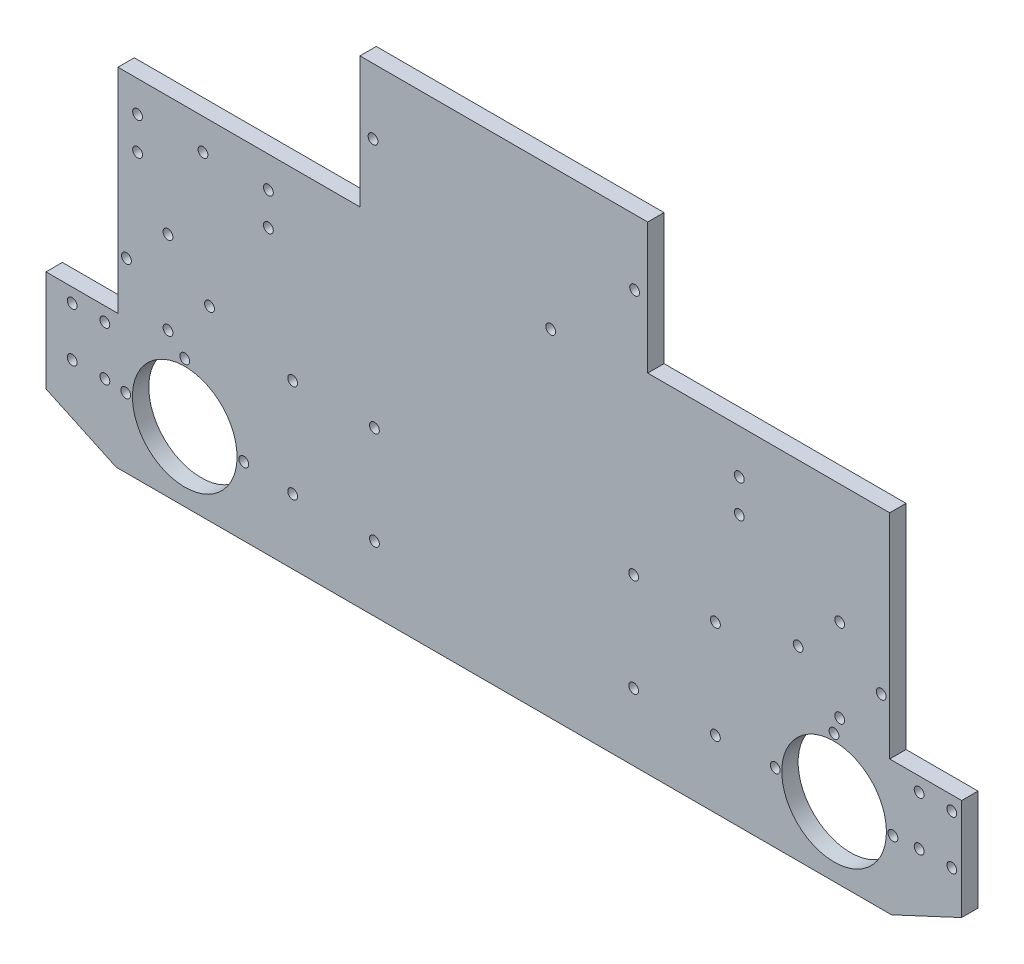
from build123d import *

# Parameters (mm, degrees)
BOSS_EXTRU_2_DEPTH       = 5
ESQUISSE2_R              = 1.5
ENL_V_MAT_EXTRU_1_DEPTH  = 14
ESQUISSE3_R              = 1.5
ENL_V_MAT_EXTRU_2_DEPTH  = 32
ESQUISSE4_R              = 1.5
ENL_V_MAT_EXTRU_3_DEPTH  = 293.72553698
ESQUISSE5_R              = 1.500580152
ENL_V_MAT_EXTRU_4_DEPTH  = 293.72553698
ESQUISSE6_R              = 1.5
ENL_V_MAT_EXTRU_5_DEPTH  = 293.72553698
ESQUISSE7_R              = 1.5
ENL_V_MAT_EXTRU_6_DEPTH  = 293.72553698
ESQUISSE8_W              = 88
ESQUISSE8_H              = 33
ENL_V_MAT_EXTRU_7_DEPTH  = 293.72553698
ESQUISSE9_R              = 1.5
ESQUISSE9_R_2            = 1.507357215
ENL_V_MAT_EXTRU_8_DEPTH  = 279.668333328
ESQUISSE10_W             = 280
ESQUISSE10_H             = 4
BOSS_EXTRU_3_DEPTH       = 5
ESQUISSE12_R             = 16
ENL_V_MAT_EXTRU_10_DEPTH = 279.668333328
ESQUISSE13_R             = 1.5
ENL_V_MAT_EXTRU_11_DEPTH = 279.668333328
CHANFREIN1_SIZE          = 10
CHANFREIN1_SIZE2         = 21.445069205
CHANFREIN2_SIZE          = 10
CHANFREIN2_SIZE2         = 21.445069205
ESQUISSE14_R             = 1.5
ENL_V_MAT_EXTRU_12_DEPTH = 279.668333328


with BuildPart() as part:
    # Esquisse1 → Boss.-Extru.2 (new body)
    with BuildSketch(Plane.XY):
        Polygon((-22, -37), (258, -37), (258, 0), (236, 0), (236, 65.2), (162, 65.2), (162, 138.2), (74, 138.2), (74, 65.2), (0, 65.2), (0, 0), (-22, 0), align=None)
    extrude(amount=BOSS_EXTRU_2_DEPTH)

    # Esquisse2 → Enlèv. mat.-Extru.1 (cut)
    with BuildSketch(Plane.XY.offset(5)):
        with Locations((26, 55.7)):
            Circle(ESQUISSE2_R)
        with Locations((46, 55.7)):
            Circle(ESQUISSE2_R)
        with Locations((6, 55.7)):
            Circle(ESQUISSE2_R)
        with Locations((6, 45.7)):
            Circle(ESQUISSE2_R)
        with Locations((-4, -4.3)):
            Circle(ESQUISSE2_R)
        with Locations((-14, -4.3)):
            Circle(ESQUISSE2_R)
        with Locations((-4, -19.3)):
            Circle(ESQUISSE2_R)
        with Locations((-14, -19.3)):
            Circle(ESQUISSE2_R)
    extrude(amount=-ENL_V_MAT_EXTRU_1_DEPTH, mode=Mode.SUBTRACT)

    # Esquisse3 → Enlèv. mat.-Extru.2 (cut)
    with BuildSketch(Plane.XY.offset(5)):
        with Locations((132.331204837, 62.002269793)):
            Circle(ESQUISSE3_R)
    extrude(amount=-ENL_V_MAT_EXTRU_2_DEPTH, mode=Mode.SUBTRACT)

    # Esquisse4 → Enlèv. mat.-Extru.3 (cut, through all)
    with BuildSketch(Plane(origin=(0, 0, 0), x_dir=(-1, 0, 0), z_dir=(0, 0, -1))):
        with Locations((-190, 51.7)):
            Circle(ESQUISSE4_R)
        with Locations((-190, 41.7)):
            Circle(ESQUISSE4_R)
    extrude(amount=-ENL_V_MAT_EXTRU_3_DEPTH, mode=Mode.SUBTRACT)

    # Esquisse5 → Enlèv. mat.-Extru.4 (cut, through all)
    with BuildSketch(Plane.XY.offset(5)):
        with Locations((46, 45.7)):
            Circle(ESQUISSE5_R)
    extrude(amount=-ENL_V_MAT_EXTRU_4_DEPTH, mode=Mode.SUBTRACT)

    # Esquisse6 → Enlèv. mat.-Extru.5 (cut, through all)
    with BuildSketch(Plane.XY.offset(5)):
        with Locations((245, -4.3)):
            Circle(ESQUISSE6_R)
        with Locations((255, -4.3)):
            Circle(ESQUISSE6_R)
        with Locations((255, -19.3)):
            Circle(ESQUISSE6_R)
        with Locations((245, -19.3)):
            Circle(ESQUISSE6_R)
    extrude(amount=-ENL_V_MAT_EXTRU_5_DEPTH, mode=Mode.SUBTRACT)

    # Esquisse7 → Enlèv. mat.-Extru.6 (cut, through all)
    with BuildSketch(Plane(origin=(0, 0, 0), x_dir=(-1, 0, 0), z_dir=(0, 0, -1))):
        with Locations((-15.3, 28.6)):
            Circle(ESQUISSE7_R)
        with Locations((-2.6, 15.9)):
            Circle(ESQUISSE7_R)
        with Locations((-15.3, 3.2)):
            Circle(ESQUISSE7_R)
        with Locations((-28, 15.9)):
            Circle(ESQUISSE7_R)
        with Locations((-208, 15.9)):
            Circle(ESQUISSE7_R)
        with Locations((-220.7, 3.2)):
            Circle(ESQUISSE7_R)
        with Locations((-233.4, 15.9)):
            Circle(ESQUISSE7_R)
        with Locations((-220.7, 28.6)):
            Circle(ESQUISSE7_R)
    extrude(amount=-ENL_V_MAT_EXTRU_6_DEPTH, mode=Mode.SUBTRACT)

    # Esquisse8 → Enlèv. mat.-Extru.7 (cut, through all)
    with BuildSketch(Plane.XY.offset(5)):
        with Locations((118, 121.7)):
            Rectangle(ESQUISSE8_W, ESQUISSE8_H)
    extrude(amount=-ENL_V_MAT_EXTRU_7_DEPTH, mode=Mode.SUBTRACT)

    # Esquisse9 → Enlèv. mat.-Extru.8 (cut, through all)
    with BuildSketch(Plane.XY.offset(5)):
        with Locations((182.7, -20.4)):
            Circle(ESQUISSE9_R)
        with Locations((157.7, -20.4)):
            Circle(ESQUISSE9_R)
        with Locations((157.7, 9.6)):
            Circle(ESQUISSE9_R)
        with Locations((182.7, 9.6)):
            Circle(ESQUISSE9_R_2)
        with Locations((78.424217253, -21.095134328)):
            Circle(ESQUISSE9_R)
        with Locations((53.424217253, -21.095134328)):
            Circle(ESQUISSE9_R)
        with Locations((78.424217253, 8.904865672)):
            Circle(ESQUISSE9_R)
        with Locations((53.424217253, 8.904865672)):
            Circle(ESQUISSE9_R)
    extrude(amount=-ENL_V_MAT_EXTRU_8_DEPTH, mode=Mode.SUBTRACT)

    # Esquisse10 → Boss.-Extru.3 (add)
    with BuildSketch(Plane.XY.offset(5)):
        with Locations((118, -39)):
            Rectangle(ESQUISSE10_W, ESQUISSE10_H)
    extrude(amount=-BOSS_EXTRU_3_DEPTH)

    # Esquisse12 → Enlèv. mat.-Extru.10 (cut, through all)
    with BuildSketch(Plane.XY.offset(5)):
        with Locations((20.424217253, -19.8)):
            Circle(ESQUISSE12_R)
        with Locations((219, -19.8)):
            Circle(ESQUISSE12_R)
    extrude(amount=-ENL_V_MAT_EXTRU_10_DEPTH, mode=Mode.SUBTRACT)

    # Esquisse13 → Enlèv. mat.-Extru.11 (cut, through all)
    with BuildSketch(Plane.XY.offset(5)):
        with Locations((2.383457441, -19.8)):
            Circle(ESQUISSE13_R)
        with Locations((20.424217253, -1.741178451)):
            Circle(ESQUISSE13_R)
        with Locations((38.478848473, -20.040125082)):
            Circle(ESQUISSE13_R)
        with Locations((218.965275761, -1.741178451)):
            Circle(ESQUISSE13_R)
        with Locations((236.986339902, -19.8)):
            Circle(ESQUISSE13_R)
        with Locations((200.994611176, -19.8)):
            Circle(ESQUISSE13_R)
    extrude(amount=-ENL_V_MAT_EXTRU_11_DEPTH, mode=Mode.SUBTRACT)

    # Chanfrein1
    chanfrein1_edges = [part.edges().sort_by_distance(p)[0] for p in [
        (-22, -41, 2.5),
    ]]
    chanfrein1_side = [part.faces().sort_by_distance(p)[0] for p in [
        (-22, -20.5, 2.5),
    ]]
    chamfer(chanfrein1_edges, length=CHANFREIN1_SIZE, length2=CHANFREIN1_SIZE2, reference=chanfrein1_side[0])

    # Chanfrein2
    chanfrein2_edges = [part.edges().sort_by_distance(p)[0] for p in [
        (258, -41, 2.5),
    ]]
    chanfrein2_side = [part.faces().sort_by_distance(p)[0] for p in [
        (258, -20.5, 2.5),
    ]]
    chamfer(chanfrein2_edges, length=CHANFREIN2_SIZE, length2=CHANFREIN2_SIZE2, reference=chanfrein2_side[0])

    # Esquisse14 → Enlèv. mat.-Extru.12 (cut, through all)
    with BuildSketch(Plane(origin=(0, 0, 0), x_dir=(-1, 0, 0), z_dir=(0, 0, -1))):
        with Locations((-158, 85.2)):
            Circle(ESQUISSE14_R)
        with Locations((-78, 85.2)):
            Circle(ESQUISSE14_R)
    extrude(amount=-ENL_V_MAT_EXTRU_12_DEPTH, mode=Mode.SUBTRACT)


solid = part.part
